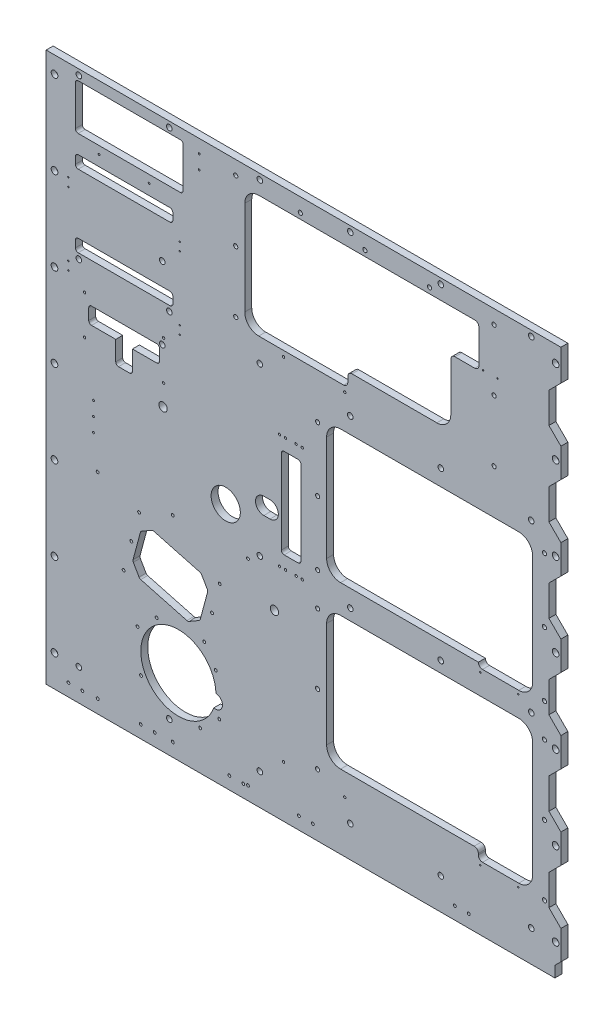
from build123d import *

# Parameters (mm, degrees)
SKETCH_1_W             = 1849
SKETCH_1_H             = 1973
SM_BASE_FLANGE_1_DEPTH = 25
CUT_EXTRUDE_2_DEPTH    = 1353.223169451
SKETCH_8_R             = 12
CUT_EXTRUDE_3_DEPTH    = 16
SKETCH_10_R            = 10
CUT_EXTRUDE_5_DEPTH    = 16
SKETCH_9_R             = 7
SKETCH_9_R_2           = 5.25
CUT_EXTRUDE_4_DEPTH    = 1353.223169451
SKETCH_11_R            = 7.5
SKETCH_11_R_2          = 3.4
SKETCH_11_R_3          = 10
SKETCH_11_R_4          = 2.55
SKETCH_11_R_5          = 4.25
SKETCH_11_R_6          = 15
SKETCH_11_R_7          = 5.15
SKETCH_11_R_8          = 52.5
SKETCH_11_W            = 387
SKETCH_11_H            = 164
SKETCH_11_W_2          = 350
SKETCH_11_H_2          = 45
SKETCH_11_W_3          = 70
SKETCH_11_H_3          = 322
CUT_EXTRUDE_6_DEPTH    = 1353.223169451
FILLET_1_R             = 10
FILLET_2_R             = 50
FILLET_3_R             = 15
FILLET_4_R             = 50
FILLET_5_R             = 15
FILLET_6_R             = 10
CHAMFER_1_SIZE         = 35
FILLET_7_R             = 10


# Sheet-metal steps are written as plain solids
with BuildPart() as part:
    # Sketch 1 → 基体-法兰1 (new body)
    with BuildSketch(Plane.XY):
        Rectangle(SKETCH_1_W, SKETCH_1_H)
    extrude(amount=-SM_BASE_FLANGE_1_DEPTH)

    # 草图6 → 切除-拉伸2 (cut, through all)
    with BuildSketch(Plane.XY):
        Polygon((924.5, 874.5), (881.5, 831.5), (881.5, 721.5), (924.5, 678.5), align=None)
        Polygon((924.5, 574.5), (881.5, 531.5), (881.5, 421.5), (924.5, 378.5), align=None)
        Polygon((924.5, 274.5), (881.5, 231.5), (881.5, 121.5), (924.5, 78.5), align=None)
        Polygon((924.5, -25.5), (881.5, -68.5), (881.5, -178.5), (924.5, -221.5), align=None)
        Polygon((924.5, -325.5), (881.5, -368.5), (881.5, -478.5), (924.5, -521.5), align=None)
        Polygon((924.5, -625.5), (881.5, -668.5), (881.5, -778.5), (924.5, -821.5), align=None)
        Polygon((924.5, -925.5), (903, -947), (903, -986.5), (924.5, -986.5), align=None)
    extrude(amount=-CUT_EXTRUDE_2_DEPTH, mode=Mode.SUBTRACT)

    # 草图8 → 切除-拉伸3 (cut)
    with BuildSketch(Plane.XY):
        with Locations((905.5, 926.5)):
            Circle(SKETCH_8_R)
        with Locations((905.5, 626.5)):
            Circle(SKETCH_8_R)
        with Locations((905.5, 326.5)):
            Circle(SKETCH_8_R)
        with Locations((905.5, 26.5)):
            Circle(SKETCH_8_R)
        with Locations((905.5, -273.5)):
            Circle(SKETCH_8_R)
        with Locations((905.5, -573.5)):
            Circle(SKETCH_8_R)
        with Locations((905.5, -873.5)):
            Circle(SKETCH_8_R)
        with Locations((-894.5, 926.5)):
            Circle(SKETCH_8_R)
        with Locations((-894.5, 626.5)):
            Circle(SKETCH_8_R)
        with Locations((-894.5, 326.5)):
            Circle(SKETCH_8_R)
        with Locations((-894.5, 26.5)):
            Circle(SKETCH_8_R)
        with Locations((-894.5, -273.5)):
            Circle(SKETCH_8_R)
        with Locations((-894.5, -573.5)):
            Circle(SKETCH_8_R)
        with Locations((-894.5, -873.5)):
            Circle(SKETCH_8_R)
    extrude(amount=-CUT_EXTRUDE_3_DEPTH, mode=Mode.SUBTRACT)

    # 草图10 → 切除-拉伸5 (cut)
    with BuildSketch(Plane.XY):
        with Locations((-807, 966.5)):
            Circle(SKETCH_10_R)
        with Locations((-482, 966.5)):
            Circle(SKETCH_10_R)
        with Locations((-157, 966.5)):
            Circle(SKETCH_10_R)
        with Locations((168, 966.5)):
            Circle(SKETCH_10_R)
        with Locations((493, 966.5)):
            Circle(SKETCH_10_R)
        with Locations((818, 966.5)):
            Circle(SKETCH_10_R)
        with Locations((-807, 394.5)):
            Circle(SKETCH_10_R)
        with Locations((493, 394.5)):
            Circle(SKETCH_10_R)
        with Locations((818, 394.5)):
            Circle(SKETCH_10_R)
        with Locations((168, 394.5)):
            Circle(SKETCH_10_R)
        with Locations((-157, 394.5)):
            Circle(SKETCH_10_R)
        with Locations((-482, 394.5)):
            Circle(SKETCH_10_R)
        with Locations((818, -203.5)):
            Circle(SKETCH_10_R)
        with Locations((493, -203.5)):
            Circle(SKETCH_10_R)
        with Locations((-157, -203.5)):
            Circle(SKETCH_10_R)
        with Locations((168, -203.5)):
            Circle(SKETCH_10_R)
        with Locations((818, -873.5)):
            Circle(SKETCH_10_R)
        with Locations((-482, -873.5)):
            Circle(SKETCH_10_R)
        with Locations((-807, -873.5)):
            Circle(SKETCH_10_R)
        with Locations((-157, -873.5)):
            Circle(SKETCH_10_R)
        with Locations((168, -873.5)):
            Circle(SKETCH_10_R)
        with Locations((493, -873.5)):
            Circle(SKETCH_10_R)
    extrude(amount=-CUT_EXTRUDE_5_DEPTH, mode=Mode.SUBTRACT)

    # 草图9 → 切除-拉伸4 (cut, through all)
    with BuildSketch(Plane.XY):
        with Locations((905.5, 926.5)):
            Circle(SKETCH_9_R)
        with Locations((905.5, 626.5)):
            Circle(SKETCH_9_R)
        with Locations((905.5, 326.5)):
            Circle(SKETCH_9_R)
        with Locations((905.5, 26.5)):
            Circle(SKETCH_9_R)
        with Locations((905.5, -273.5)):
            Circle(SKETCH_9_R)
        with Locations((905.5, -573.5)):
            Circle(SKETCH_9_R)
        with Locations((905.5, -873.5)):
            Circle(SKETCH_9_R)
        with Locations((-894.5, 926.5)):
            Circle(SKETCH_9_R)
        with Locations((-894.5, 626.5)):
            Circle(SKETCH_9_R)
        with Locations((-894.5, 326.5)):
            Circle(SKETCH_9_R)
        with Locations((-894.5, 26.5)):
            Circle(SKETCH_9_R)
        with Locations((-894.5, -273.5)):
            Circle(SKETCH_9_R)
        with Locations((-894.5, -573.5)):
            Circle(SKETCH_9_R)
        with Locations((-894.5, -873.5)):
            Circle(SKETCH_9_R)
        with Locations((818, 966.5)):
            Circle(SKETCH_9_R_2)
        with Locations((493, 966.5)):
            Circle(SKETCH_9_R_2)
        with Locations((168, 966.5)):
            Circle(SKETCH_9_R_2)
        with Locations((-157, 966.5)):
            Circle(SKETCH_9_R_2)
        with Locations((-482, 966.5)):
            Circle(SKETCH_9_R_2)
        with Locations((-807, 966.5)):
            Circle(SKETCH_9_R_2)
        with Locations((-807, 394.5)):
            Circle(SKETCH_9_R_2)
        with Locations((-482, 394.5)):
            Circle(SKETCH_9_R_2)
        with Locations((-157, 394.5)):
            Circle(SKETCH_9_R_2)
        with Locations((168, 394.5)):
            Circle(SKETCH_9_R_2)
        with Locations((493, 394.5)):
            Circle(SKETCH_9_R_2)
        with Locations((818, 394.5)):
            Circle(SKETCH_9_R_2)
        with Locations((818, -203.5)):
            Circle(SKETCH_9_R_2)
        with Locations((493, -203.5)):
            Circle(SKETCH_9_R_2)
        with Locations((168, -203.5)):
            Circle(SKETCH_9_R_2)
        with Locations((-157, -203.5)):
            Circle(SKETCH_9_R_2)
        with Locations((-807, -873.5)):
            Circle(SKETCH_9_R_2)
        with Locations((-482, -873.5)):
            Circle(SKETCH_9_R_2)
        with Locations((-157, -873.5)):
            Circle(SKETCH_9_R_2)
        with Locations((168, -873.5)):
            Circle(SKETCH_9_R_2)
        with Locations((493, -873.5)):
            Circle(SKETCH_9_R_2)
        with Locations((818, -873.5)):
            Circle(SKETCH_9_R_2)
    extrude(amount=-CUT_EXTRUDE_4_DEPTH, mode=Mode.SUBTRACT)

    # 草图11 → 切除-拉伸6 (cut, through all)
    with BuildSketch(Plane.XY):
        with Locations((-243.5, 936.5)):
            Circle(SKETCH_11_R)
        with Locations((-243.5, 716.5)):
            Circle(SKETCH_11_R)
        with Locations((-243.5, 496.5)):
            Circle(SKETCH_11_R)
        with Locations((-11.5, 936.5)):
            Circle(SKETCH_11_R)
        with Locations((220.5, 936.5)):
            Circle(SKETCH_11_R)
        with Locations((452.5, 936.5)):
            Circle(SKETCH_11_R)
        with Locations((684.5, 936.5)):
            Circle(SKETCH_11_R)
        with Locations((684.5, 716.5)):
            Circle(SKETCH_11_R)
        with Locations((684.5, 496.5)):
            Circle(SKETCH_11_R)
        with Locations((-374.5, 938.5)):
            Circle(SKETCH_11_R_2)
        with Locations((-374.5, 888.5)):
            Circle(SKETCH_11_R_2)
        with Locations((-734.5, 756.5)):
            Circle(SKETCH_11_R_2)
        with Locations(Location((-554.5, 756.5, 0), (0, 0, 180))):
            Circle(SKETCH_11_R_2)
        with Locations((-507.5, 538.5)):
            Circle(SKETCH_11_R_3)
        with Locations((-507.5, 278.5)):
            Circle(SKETCH_11_R_3)
        with Locations((-844.5, 630.5)):
            Circle(SKETCH_11_R_4)
        with Locations((-844.5, 600.5)):
            Circle(SKETCH_11_R_4)
        with Locations((-844.5, 370.5)):
            Circle(SKETCH_11_R_4)
        with Locations((-844.5, 340.5)):
            Circle(SKETCH_11_R_4)
        with Locations(Location((-444.5, 340.5, 0), (0, 0, 180))):
            Circle(SKETCH_11_R_4)
        with Locations(Location((-444.5, 370.5, 0), (0, 0, 180))):
            Circle(SKETCH_11_R_4)
        with Locations(Location((-444.5, 600.5, 0), (0, 0, 180))):
            Circle(SKETCH_11_R_4)
        with Locations(Location((-444.5, 630.5, 0), (0, 0, 180))):
            Circle(SKETCH_11_R_4)
        with Locations((-786.5, 301.5)):
            Circle(SKETCH_11_R_5)
        with Locations((-786.5, 161.5)):
            Circle(SKETCH_11_R_5)
        with Locations(Location((-502.5, 161.5, 0), (0, 0, 180))):
            Circle(SKETCH_11_R_5)
        with Locations(Location((-502.5, 301.5, 0), (0, 0, 180))):
            Circle(SKETCH_11_R_5)
        with Locations((-504.5, 86.5)):
            Circle(SKETCH_11_R_6)
        with Locations((-754.5, -18.5)):
            Circle(SKETCH_11_R_2)
        with Locations((-754.5, -68.5)):
            Circle(SKETCH_11_R_2)
        with Locations((-754.5, -118.5)):
            Circle(SKETCH_11_R_2)
        with Locations((645, 775)):
            Circle(SKETCH_11_R_4)
        with Locations((697, 775)):
            Circle(SKETCH_11_R_4)
        with Locations((50.5, 316.5)):
            Circle(SKETCH_11_R)
        with Locations((865.5, 316.5)):
            Circle(SKETCH_11_R)
        with Locations((865.5, 86.5)):
            Circle(SKETCH_11_R)
        with Locations((865.5, -263.5)):
            Circle(SKETCH_11_R)
        with Locations((50.5, 86.5)):
            Circle(SKETCH_11_R)
        with Locations((50.5, -263.5)):
            Circle(SKETCH_11_R)
        with Locations((50.5, -143.5)):
            Circle(SKETCH_11_R)
        with Locations((50.5, -763.5)):
            Circle(SKETCH_11_R)
        with Locations((50.5, -513.5)):
            Circle(SKETCH_11_R)
        with Locations((865.5, -143.5)):
            Circle(SKETCH_11_R)
        with Locations((865.5, -763.5)):
            Circle(SKETCH_11_R)
        with Locations((865.5, -513.5)):
            Circle(SKETCH_11_R)
        with Locations((-72, 458.5)):
            Circle(SKETCH_11_R_5)
        with Locations((148, 458.5)):
            Circle(SKETCH_11_R_5)
        with Locations((635, -170)):
            Circle(SKETCH_11_R_4)
        with Locations((771, -170)):
            Circle(SKETCH_11_R_4)
        with Locations((635, -770)):
            Circle(SKETCH_11_R_4)
        with Locations((771, -770)):
            Circle(SKETCH_11_R_4)
        with Locations((593.5, -941.5)):
            Circle(SKETCH_11_R_7)
        with Locations((543.5, -941.5)):
            Circle(SKETCH_11_R_7)
        with Locations((-16.5, -941.5)):
            Circle(SKETCH_11_R_7)
        with Locations((33.5, -941.5)):
            Circle(SKETCH_11_R_7)
        with Locations((-266.5, -941.5)):
            Circle(SKETCH_11_R_7)
        with Locations((-216.5, -941.5)):
            Circle(SKETCH_11_R_7)
        with Locations((-844.5, -941.5)):
            Circle(SKETCH_11_R_7)
        with Locations((-584.5, -941.5)):
            Circle(SKETCH_11_R_7)
        with Locations((-534.5, -941.5)):
            Circle(SKETCH_11_R_7)
        with Locations((-794.5, -941.5)):
            Circle(SKETCH_11_R_7)
        with Locations((148, -801.5)):
            Circle(SKETCH_11_R_5)
        with Locations((-72, -801.5)):
            Circle(SKETCH_11_R_5)
        with Locations((-86.5, 209.5)):
            Circle(SKETCH_11_R_5)
        with Locations((-64.5, 209.5)):
            Circle(SKETCH_11_R_5)
        with Locations((-26.5, 209.5)):
            Circle(SKETCH_11_R_5)
        with Locations((-4.5, 209.5)):
            Circle(SKETCH_11_R_5)
        with Locations((-86.5, -200.5)):
            Circle(SKETCH_11_R_5)
        with Locations((-64.5, -200.5)):
            Circle(SKETCH_11_R_5)
        with Locations((-4.5, -200.5)):
            Circle(SKETCH_11_R_5)
        with Locations((-26.5, -200.5)):
            Circle(SKETCH_11_R_5)
        with Locations((-104.5, -346.5)):
            Circle(SKETCH_11_R_6)
        with Locations((-739.5, -938.5)):
            Circle(SKETCH_11_R_7)
        with Locations((-469.5, -938.5)):
            Circle(SKETCH_11_R_7)
        with Locations((-199.5, -938.5)):
            Circle(SKETCH_11_R_7)
        with Locations((-739.5, -233.5)):
            Circle(SKETCH_11_R_7)
        with Locations((-469.5, -233.5)):
            Circle(SKETCH_11_R_7)
        with Locations((-199.5, -233.5)):
            Circle(SKETCH_11_R_7)
        with Locations((-279.5, -103.5)):
            Circle(SKETCH_11_R_8)
        with Locations((-527.928793543, -581.192878713)):
            Circle(SKETCH_11_R_7)
        with Locations((-596.283560853, -643.111177995)):
            Circle(SKETCH_11_R_7)
        with Locations((-583.57488824, -788.866931365)):
            Circle(SKETCH_11_R_7)
        with Locations(Location((-371.071206457, -845.807121287, 0), (0, 0, 180))):
            Circle(SKETCH_11_R_7)
        with Locations(Location((-315.42511176, -638.133068635, 0), (0, 0, 180))):
            Circle(SKETCH_11_R_7)
        with Locations((-590.669267315, -284.857050722)):
            Circle(SKETCH_11_R_7)
        with Locations((-300.891519428, -362.502764253)):
            Circle(SKETCH_11_R_7)
        with Locations(Location((-356.537614125, -570.176816905, 0), (0, 0, 180))):
            Circle(SKETCH_11_R_7)
        with Locations(Location((-646.315362012, -492.531103374, 0), (0, 0, 180))):
            Circle(SKETCH_11_R_7)
        with Locations((-328.714566777, -466.339790579)):
            Circle(SKETCH_11_R_7)
        with Locations((-618.492314664, -388.694077048)):
            Circle(SKETCH_11_R_7)
        with Locations((-302.716439147, -783.888822005)):
            Circle(SKETCH_11_R_7)
        Polygon((-517.5, 271.5), (-771.5, 271.5), (-771.5, 211.5), (-674.5, 211.5), (-674.5, 131.5), (-614.5, 131.5), (-614.5, 211.5), (-517.5, 211.5), align=None)
        with Locations((-626, 866.5)):
            Rectangle(SKETCH_11_W, SKETCH_11_H)
        with Locations((-644.5, 696)):
            Rectangle(SKETCH_11_W_2, SKETCH_11_H_2)
        with Locations((-644.5, 436)):
            Rectangle(SKETCH_11_W_2, SKETCH_11_H_2)
        Polygon((-211, 916.5), (630, 916.5), (630, 766.5), (529, 766.5), (529, 528.5), (159, 528.5), (159, 478.5), (-211, 478.5), align=None)
        Polygon((83, -141.5), (628, -141.5), (628, -156.5), (823, -156.5), (823, 336.5), (83, 336.5), align=None)
        Polygon((83, -243.5), (823, -243.5), (823, -756.5), (628, -756.5), (628, -721.5), (83, -721.5), align=None)
        with Locations((-44.5, 4.5)):
            Rectangle(SKETCH_11_W_3, SKETCH_11_H_3)
        with BuildLine():
            Line((-142.5, -10.5), (-120.5, -10.5))
            ThreePointArc((-120.5, -10.5), (-90.5, -40.5), (-120.5, -70.5))
            Line((-120.5, -70.5), (-142.5, -70.5))
            ThreePointArc((-142.5, -70.5), (-172.5, -40.5), (-142.5, -10.5))
        make_face()
        Polygon((-334.398627506, -371.64189486), (-575.880084079, -306.937133584), (-622.467512197, -480.803782316), (-380.986055625, -545.508543592), align=None)
        with BuildLine():
            ThreePointArc((-314.554328752, -709.67040324), (-582.83792598, -692.38134722), (-322.342450494, -758.842668687))
            ThreePointArc((-322.342450494, -758.842668687), (-291.469865505, -738.529514406), (-314.554328752, -709.67040324))
        make_face()
    extrude(amount=-CUT_EXTRUDE_6_DEPTH, mode=Mode.SUBTRACT)

    # 圆角1
    fillet_1_edges = [part.edges().sort_by_distance(p)[0] for p in [
        (-819.5, 784.5, -12.5),
        (-819.5, 948.5, -12.5),
        (-432.5, 948.5, -12.5),
        (-432.5, 784.5, -12.5),
        (-771.5, 211.5, -12.5),
        (-771.5, 271.5, -12.5),
        (-517.5, 271.5, -12.5),
        (-517.5, 211.5, -12.5),
        (-614.5, 131.5, -12.5),
        (-674.5, 131.5, -12.5),
        (-819.5, 413.5, -12.5),
        (-819.5, 458.5, -12.5),
        (-469.5, 458.5, -12.5),
        (-469.5, 413.5, -12.5),
        (-819.5, 673.5, -12.5),
        (-819.5, 718.5, -12.5),
        (-469.5, 718.5, -12.5),
        (-469.5, 673.5, -12.5),
    ]]
    fillet(fillet_1_edges, radius=FILLET_1_R)

    # 圆角2
    fillet_2_edges = [part.edges().sort_by_distance(p)[0] for p in [
        (-211, 478.5, -12.5),
        (-211, 916.5, -12.5),
        (529, 528.5, -12.5),
    ]]
    fillet(fillet_2_edges, radius=FILLET_2_R)

    # 圆角3
    fillet_3_edges = [part.edges().sort_by_distance(p)[0] for p in [
        (630, 916.5, -12.5),
        (630, 766.5, -12.5),
        (529, 766.5, -12.5),
        (159, 528.5, -12.5),
        (159, 478.5, -12.5),
    ]]
    fillet(fillet_3_edges, radius=FILLET_3_R)

    # 圆角4
    fillet_4_edges = [part.edges().sort_by_distance(p)[0] for p in [
        (83, -141.5, -12.5),
        (83, 336.5, -12.5),
        (823, 336.5, -12.5),
        (823, -156.5, -12.5),
        (83, -721.5, -12.5),
        (83, -243.5, -12.5),
        (823, -243.5, -12.5),
        (823, -756.5, -12.5),
    ]]
    fillet(fillet_4_edges, radius=FILLET_4_R)

    # 圆角5
    fillet_5_edges = [part.edges().sort_by_distance(p)[0] for p in [
        (628, -156.5, -12.5),
        (628, -756.5, -12.5),
        (628, -721.5, -12.5),
    ]]
    fillet(fillet_5_edges, radius=FILLET_5_R - 0.0001)  # a hair under: the kernel refuses the full size

    # 圆角6
    fillet_6_edges = [part.edges().sort_by_distance(p)[0] for p in [
        (-79.5, -156.5, -12.5),
        (-79.5, 165.5, -12.5),
        (-9.5, 165.5, -12.5),
        (-9.5, -156.5, -12.5),
    ]]
    fillet(fillet_6_edges, radius=FILLET_6_R)

    # 倒角1
    chamfer_1_edges = [part.edges().sort_by_distance(p)[0] for p in [
        (-622.467512197, -480.803782316, -12.5),
        (-575.880084079, -306.937133584, -12.5),
        (-334.398627506, -371.64189486, -12.5),
        (-380.986055625, -545.508543592, -12.5),
    ]]
    chamfer(chamfer_1_edges, length=CHAMFER_1_SIZE)

    # 圆角7
    fillet_7_edges = [part.edges().sort_by_distance(p)[0] for p in [
        (-613.408845618, -446.996378396, -12.5),
        (-584.938750657, -340.744537504, -12.5),
        (-368.206031426, -362.583228281, -12.5),
        (-542.072680158, -315.995800163, -12.5),
        (-414.793459545, -536.449877013, -12.5),
        (-588.660108277, -489.862448895, -12.5),
        (-343.457294085, -405.44929878, -12.5),
        (-371.927389046, -511.701139672, -12.5),
    ]]
    fillet(fillet_7_edges, radius=FILLET_7_R)


solid = part.part
